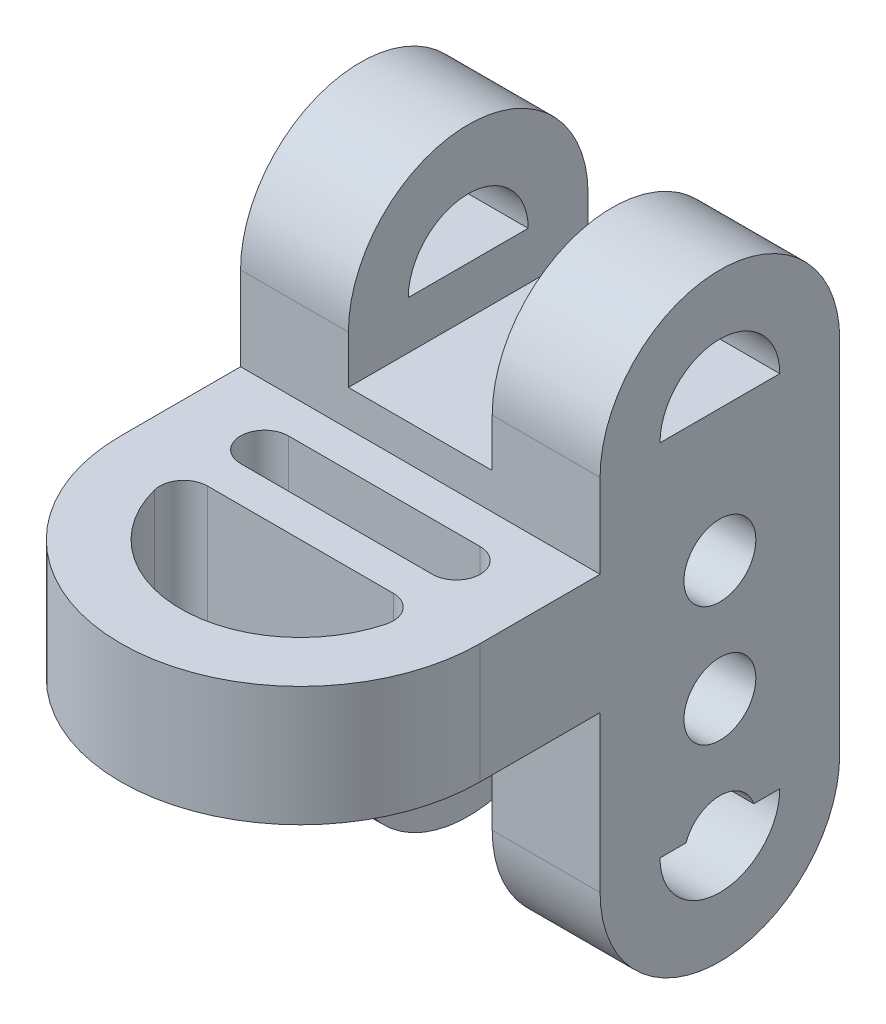
from build123d import *

# Parameters (mm, degrees)
SKETCH2_R           = 2.5
BOSS_EXTRUDE2_DEPTH = 7.5
SKETCH3_W           = 6
SKETCH3_H           = 10
CUT_EXTRUDE1_DEPTH  = 7.5
SKETCH4_R           = 1.5
CUT_EXTRUDE2_DEPTH  = 15
SKETCH6_W           = 6
SKETCH6_H           = 2
CUT_EXTRUDE3_DEPTH  = 15
SKETCH7_W           = 15
SKETCH7_H           = 5
BOSS_EXTRUDE3_DEPTH = 5
BOSS_EXTRUDE4_DEPTH = 5
FILLET1_R           = 1
CUT_EXTRUDE4_DEPTH  = 5


with BuildPart() as part:
    # Sketch2 → Boss-Extrude2 (new, symmetric)
    with BuildSketch(Plane(origin=(0, 0, 0), x_dir=(0, 0, -1), z_dir=(1, 0, 0))):
        with BuildLine():
            Line((-5, 8), (-5, -7))
            Line((-5, -7), (5, -7))
            Line((5, -7), (5, 8))
            ThreePointArc((5, 8), (0, 13), (-5, 8))
        make_face()
        with Locations((0, 8)):
            Circle(SKETCH2_R, mode=Mode.SUBTRACT)
    boss_extrude2 = extrude(amount=BOSS_EXTRUDE2_DEPTH, both=True)

    # Sketch3 → Cut-Extrude1 (cut, symmetric)
    with BuildSketch(Plane.XY):
        with Locations((0, 8)):
            Rectangle(SKETCH3_W, SKETCH3_H)
    cut_extrude1 = extrude(amount=CUT_EXTRUDE1_DEPTH, both=True, mode=Mode.SUBTRACT)

    # Mirror1: Boss-Extrude2, Cut-Extrude1 across plane
    add(boss_extrude2.mirror(Plane(origin=(0, 0.5, 0), x_dir=(0, 0, 1), z_dir=(0, -1, 0))))
    add(cut_extrude1.mirror(Plane(origin=(0, 0.5, 0), x_dir=(0, 0, 1), z_dir=(0, -1, 0))), mode=Mode.SUBTRACT)

    # Sketch4 → Cut-Extrude2 (cut)
    with BuildSketch(Plane(origin=(7.5, 0, 0), x_dir=(0, 0, -1), z_dir=(1, 0, 0))):
        with Locations((0, 2.5)):
            Circle(SKETCH4_R)
        with Locations((0, -2.5)):
            Circle(SKETCH4_R)
        with Locations((0, -7.5)):
            Circle(SKETCH4_R)
    extrude(amount=-CUT_EXTRUDE2_DEPTH, mode=Mode.SUBTRACT)

    # Sketch6 → Cut-Extrude3 (cut)
    with BuildSketch(Plane.XY.offset(5)):
        with Locations((0, 7)):
            Rectangle(SKETCH6_W, SKETCH6_H)
    extrude(amount=-CUT_EXTRUDE3_DEPTH, mode=Mode.SUBTRACT)

    # Sketch7 → Boss-Extrude3 (add)
    with BuildSketch(Plane.XY.offset(5)):
        with Locations((0, 2)):
            Rectangle(SKETCH7_W, SKETCH7_H)
    extrude(amount=BOSS_EXTRUDE3_DEPTH)

    # Sketch8 → Boss-Extrude4 (add)
    with BuildSketch(Plane(origin=(0, 4.5, 0), x_dir=(1, 0, 0), z_dir=(0, 1, 0))):
        with BuildLine():
            ThreePointArc((5, -10), (0, -15), (-5, -10))
            Line((-5, -10), (-7.5, -10))
            ThreePointArc((-7.5, -10), (0, -17.5), (7.5, -10))
            Line((7.5, -10), (5, -10))
        make_face()
    extrude(amount=-BOSS_EXTRUDE4_DEPTH)

    # Fillet1
    fillet1_edges = [part.edges().sort_by_distance(p)[0] for p in [
        (-5, 2, 10),
        (5, 2, 10),
    ]]
    fillet(fillet1_edges, radius=FILLET1_R)

    # Sketch9 → Cut-Extrude4 (cut)
    with BuildSketch(Plane(origin=(0, 4.5, 0), x_dir=(1, 0, 0), z_dir=(0, 1, 0))):
        with BuildLine():
            Line((-4, -6.5), (4, -6.5))
            ThreePointArc((4, -6.5), (5, -7.5), (4, -8.5))
            Line((4, -8.5), (-4, -8.5))
            ThreePointArc((-4, -8.5), (-5, -7.5), (-4, -6.5))
        make_face()
    extrude(amount=-CUT_EXTRUDE4_DEPTH, mode=Mode.SUBTRACT)


solid = part.part
